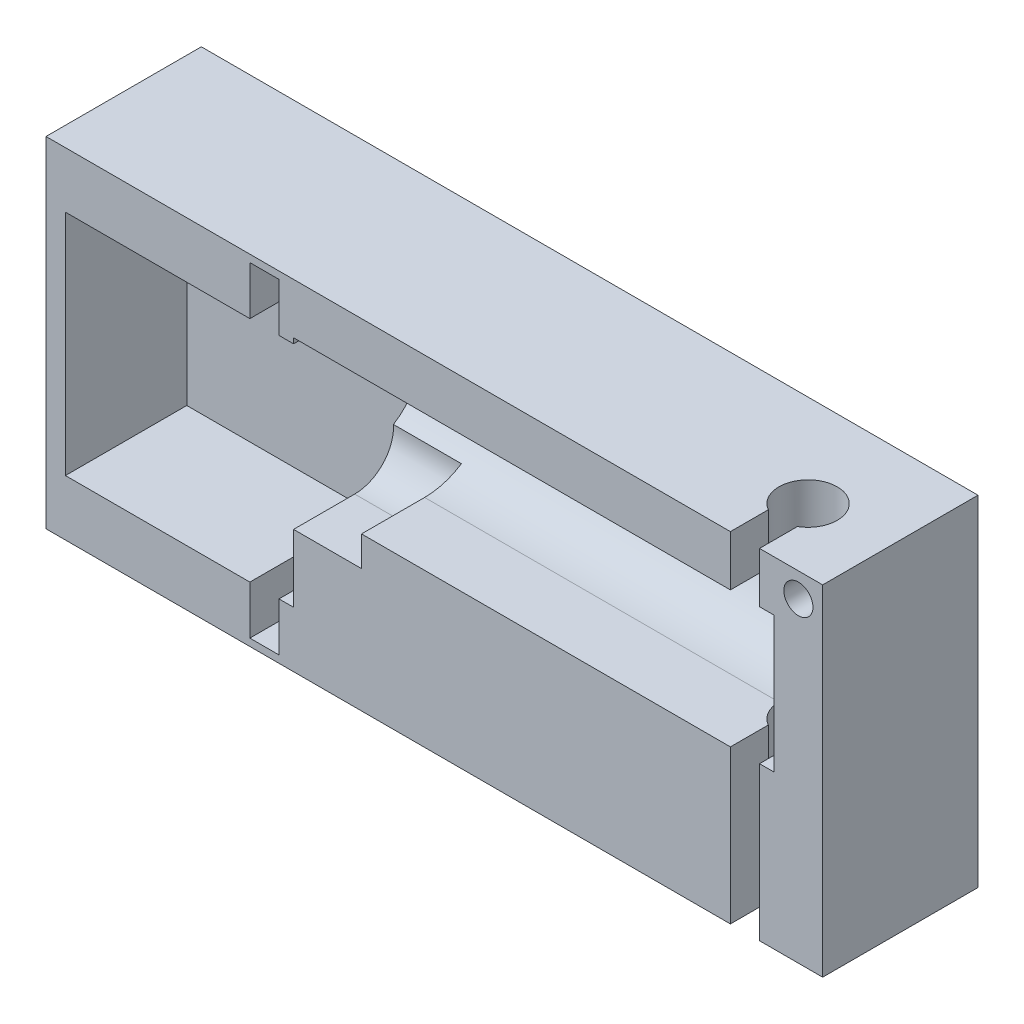
from build123d import *

# Parameters (mm, degrees)
SKETCH1_W           = 75
SKETCH1_H           = 35
BOSS_EXTRUDE5_DEPTH = 16
CUT_EXTRUDE1_DEPTH  = 12.5
CUT_EXTRUDE2_REACH  = 56.886
CUT_EXTRUDE3_DEPTH  = 7
SKETCH6_W           = 16
SKETCH6_H           = 35
BOSS_EXTRUDE6_DEPTH = 5
CUT_EXTRUDE4_DEPTH  = 58.334544561
SKETCH8_R           = 1.5
CUT_EXTRUDE5_DEPTH  = 13


with BuildPart() as part:
    # Sketch1 → Boss-Extrude5 (new body)
    with BuildSketch(Plane.XY):
        Rectangle(SKETCH1_W, SKETCH1_H)
    extrude(amount=BOSS_EXTRUDE5_DEPTH)

    # Sketch2 → Cut-Extrude1 (cut)
    with BuildSketch(Plane.XY.offset(16)):
        Polygon((-35.5, 11.75), (-16.5, 11.75), (-16.5, 16.75), (-13.5, 16.75), (-13.5, 11.75), (-12, 11.75), (-12, -11.75), (-13.5, -11.75), (-13.5, -16.75), (-16.5, -16.75), (-16.5, -11.75), (-35.5, -11.75), align=None)
    extrude(amount=-CUT_EXTRUDE1_DEPTH, mode=Mode.SUBTRACT)

    # Sketch3 → Cut-Extrude2 (cut, up to next)
    with BuildSketch(Plane.ZY.offset(12), mode=Mode.PRIVATE) as cut_extrude2_sk1:
        with BuildLine():
            Line((9.5, 12.296655642), (16, 12.296655642))
            Line((16, 12.296655642), (16, -1.703344358))
            Line((16, -1.703344358), (9.5, -1.703344358))
            ThreePointArc((9.5, -1.703344358), (2.5, 5.296655642), (9.5, 12.296655642))
        make_face()
    cut_extrude2_tool1 = extrude(cut_extrude2_sk1.sketch, amount=-CUT_EXTRUDE2_REACH, mode=Mode.PRIVATE) & part.part
    add(cut_extrude2_tool1.solids().sort_by_distance((-12, 5.296656, 9.899379))[0], mode=Mode.SUBTRACT)

    # Sketch5 → Cut-Extrude3 (cut)
    with BuildSketch(Plane.ZY.offset(12)):
        with BuildLine():
            Line((9.702025117, -4.799998018), (16, -4.799998018))
            Line((16, -4.799998018), (16, 3.200001982))
            Line((16, 3.200001982), (9.702025117, 3.200001982))
            ThreePointArc((9.702025117, 3.200001982), (5.702025117, -0.799998018), (9.702025117, -4.799998018))
        make_face()
    extrude(amount=-CUT_EXTRUDE3_DEPTH, mode=Mode.SUBTRACT)

    # Sketch6 → Boss-Extrude6 (add)
    with BuildSketch(Plane(origin=(37.5, 0, 0), x_dir=(0, 0, -1), z_dir=(1, 0, 0))):
        with Locations((-8, 0)):
            Rectangle(SKETCH6_W, SKETCH6_H)
    extrude(amount=BOSS_EXTRUDE6_DEPTH)

    # Sketch7 → Cut-Extrude4 (cut, through all)
    with BuildSketch(Plane.XZ.offset(17.5)):
        with BuildLine():
            Line((32.99668066, 12.098076211), (32.99668066, 16))
            Line((32.99668066, 16), (35.99668066, 16))
            Line((35.99668066, 16), (35.99668066, 12.098076211))
            ThreePointArc((35.99668066, 12.098076211), (34.49668066, 6.5), (32.99668066, 12.098076211))
        make_face()
    extrude(amount=-CUT_EXTRUDE4_DEPTH, mode=Mode.SUBTRACT)

    # Sketch8 → Cut-Extrude5 (cut)
    with BuildSketch(Plane.XY.offset(16)):
        with Locations((40, 15)):
            Circle(SKETCH8_R)
    extrude(amount=-CUT_EXTRUDE5_DEPTH, mode=Mode.SUBTRACT)


solid = part.part
